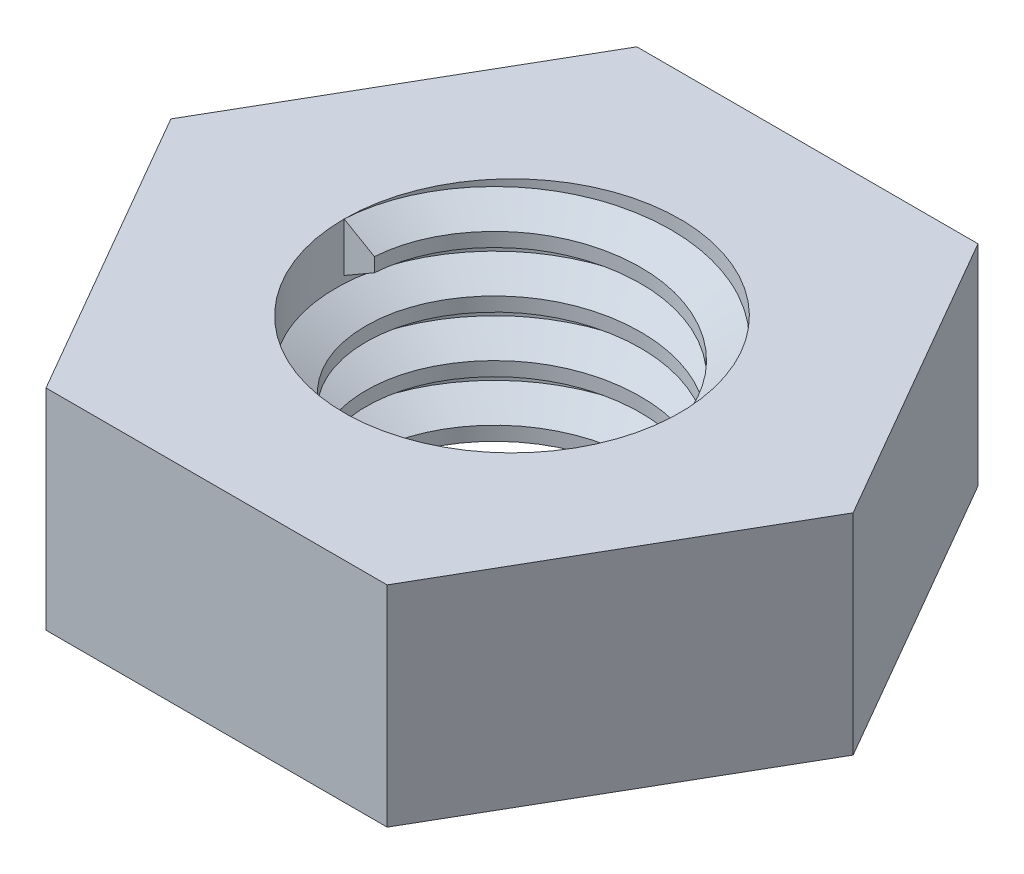
from build123d import *

# Parameters (mm, degrees)
SKETCH1_R           = 3.175
BOSS_EXTRUDE3_DEPTH = 3.96875
THREAD1_PITCH       = 1.058333333
SKETCH5_W           = 11.495261482
SKETCH5_H           = 9.373628012
CUT_EXTRUDE1_DEPTH  = 3.96875


with BuildPart() as part:
    # Sketch1 → Boss-Extrude3 (new body)
    with BuildSketch(Plane(origin=(0, 0, 0), x_dir=(1, 0, 0), z_dir=(0, 1, 0))):
        Polygon((-3.226233304, -5.588), (3.226233304, -5.588), (6.452466608, 0), (3.226233304, 5.588), (-3.226233304, 5.588), (-6.452466608, 0), align=None)
        with Locations(Location((0, 0, 0), (0, 0, 270))):
            Circle(SKETCH1_R, mode=Mode.SUBTRACT)
    extrude(amount=BOSS_EXTRUDE3_DEPTH)

    # Thread1: the profile of Thread Profile1 profile screwed along a right-hand helix of 3.75 turns, 8 arcs to a turn; built about Z, then put on its axis
    thread1_z = Axis((0, 0, 0), (0, 0, 1))
    thread1_corners = [(3.1753, 0, -0.000173205), (3.1753, 0, 0.926214869), (2.602160282, 0, 0.595312499), (2.602160282, 0, 0.330729165)]
    with BuildLine(mode=Mode.PRIVATE) as thread1_profile:
        Line(thread1_corners[0], thread1_corners[1])
        Line(thread1_corners[1], thread1_corners[2])
        Line(thread1_corners[2], thread1_corners[3])
        Line(thread1_corners[3], thread1_corners[0])
    thread1_cap = Face(thread1_profile.wire())
    thread1_turn_angles = [0, 22.5, 45, 67.5, 90, 112.5, 135, 157.5, 180, 202.5, 225, 247.5, 270, 292.5, 315, 337.5, 360]
    thread1_turn_weights = [1, 0.9238795325112867, 1, 0.9238795325112867, 1, 0.9238795325112867, 1, 0.9238795325112867, 1, 0.9238795325112867, 1, 0.9238795325112867, 1, 0.9238795325112867, 1, 0.9238795325112867, 1]
    thread1_turn_rails = [Edge.make_bspline([Vector(p[0], p[1], 0).rotate(thread1_z, thread1_turn_angles[k]) / thread1_turn_weights[k] + Vector(0, 0, p[2] + THREAD1_PITCH * thread1_turn_angles[k] / 360) for k in range(17)], [0, 0, 0, 1, 1, 2, 2, 3, 3, 4, 4, 5, 5, 6, 6, 7, 7, 8, 8, 8], 2, thread1_turn_weights) for p in thread1_corners]
    thread1_turn_sides = [Face.make_surface_from_curves(thread1_turn_rails[p[0]], thread1_turn_rails[p[1]]) for p in [(0, 1), (1, 2), (2, 3), (3, 0)]]
    thread1_last_angles = [1080, 1102.5, 1125, 1147.5, 1170, 1192.5, 1215, 1237.5, 1260, 1282.5, 1305, 1327.5, 1350]
    thread1_last_weights = [1, 0.9238795325112867, 1, 0.9238795325112867, 1, 0.9238795325112867, 1, 0.9238795325112867, 1, 0.9238795325112867, 1, 0.923879532511286, 1]
    thread1_last_rails = [Edge.make_bspline([Vector(p[0], p[1], 0).rotate(thread1_z, thread1_last_angles[k]) / thread1_last_weights[k] + Vector(0, 0, p[2] + THREAD1_PITCH * thread1_last_angles[k] / 360) for k in range(13)], [0, 0, 0, 1, 1, 2, 2, 3, 3, 4, 4, 5, 5, 6, 6, 6], 2, thread1_last_weights) for p in thread1_corners]
    thread1_last_sides = [Face.make_surface_from_curves(thread1_last_rails[p[0]], thread1_last_rails[p[1]]) for p in [(0, 1), (1, 2), (2, 3), (3, 0)]]
    thread1 = Plane(origin=(0, 3.96875, 0), x_dir=(-1, 0, 0), z_dir=(0, -1, 0)) * Solid(Shell([*[p.moved(Location((0, 0, THREAD1_PITCH * i))) for i in range(3) for p in thread1_turn_sides], *thread1_last_sides, thread1_cap, thread1_cap.rotate(thread1_z, 1350).moved(Location((0, 0, THREAD1_PITCH * 1350 / 360)))]))
    add(thread1)

    # Sketch5 → Cut-Extrude1 (cut)
    with BuildSketch(Plane(origin=(0, 0, 0), x_dir=(-1, 0, 0), z_dir=(0, -1, 0))):
        with Locations((0.048050932, -0.317875398)):
            Rectangle(SKETCH5_W, SKETCH5_H)
    extrude(amount=CUT_EXTRUDE1_DEPTH, mode=Mode.SUBTRACT)


solid = part.part
